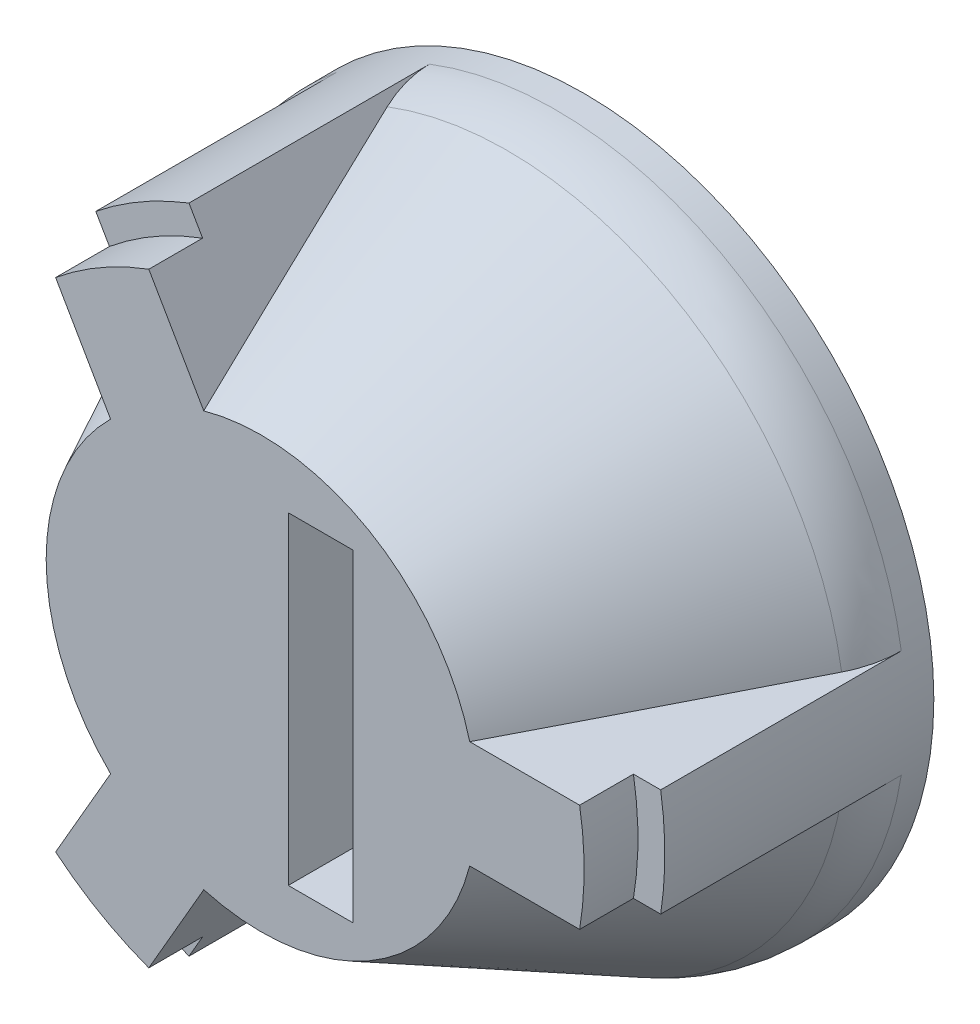
from build123d import *

# Parameters (mm, degrees)
BOSS_EXTRU_1_DEPTH      = 12
ESQUISSE5_R             = 12.2
ENL_V_MAT_EXTRU_1_DEPTH = 2.5
CONG_2_R                = 4
ESQUISSE7_W             = 2.4
ESQUISSE7_H             = 12
ENL_V_MAT_EXTRU_2_DEPTH = 5


with BuildPart() as part:
    # Esquisse1 → Boss.-Extru.1 (new body)
    with BuildSketch(Plane.XY):
        with BuildLine():
            ThreePointArc((13.856406461, -2), (14, 0), (13.856406461, 2))
            Line((13.856406461, 2), (7.745966692, 2))
            ThreePointArc((7.745966692, 2), (6.368966176, 4.841102131), (4, 6.92820323))
            ThreePointArc((4, 6.92820323), (1.00803434, 7.93623757), (-2.140932539, 7.708203932))
            Line((-2.140932539, 7.708203932), (-5.196152423, 13))
            ThreePointArc((-5.196152423, 13), (-7, 12.124355653), (-8.660254038, 11))
            Line((-8.660254038, 11), (-5.605034154, 5.708203932))
            ThreePointArc((-5.605034154, 5.708203932), (-7.377000516, 3.095135439), (-8, 0))
            ThreePointArc((-8, 0), (-7.377000516, -3.095135439), (-5.605034154, -5.708203932))
            Line((-5.605034154, -5.708203932), (-8.660254038, -11))
            ThreePointArc((-8.660254038, -11), (-7, -12.124355653), (-5.196152423, -13))
            Line((-5.196152423, -13), (-2.140932539, -7.708203932))
            ThreePointArc((-2.140932539, -7.708203932), (1.00803434, -7.93623757), (4, -6.92820323))
            ThreePointArc((4, -6.92820323), (6.368966176, -4.841102131), (7.745966692, -2))
            Line((7.745966692, -2), (13.856406461, -2))
        make_face()
    extrude(amount=BOSS_EXTRU_1_DEPTH)

    # Esquisse4 → Révolution1 (revolve)
    with BuildSketch(Plane(origin=(0, 0, 0), x_dir=(1, 0, 0), z_dir=(0, 1, 0))):
        Polygon((14, 0), (8, -12), (0, -12), (0, 0), align=None)
    revolve(axis=Axis((0, 0, 12), (0, 0, -1)))

    # Esquisse5 → Enlèv. mat.-Extru.1 (cut)
    with BuildSketch(Plane(origin=(0, 0, 0), x_dir=(-1, 0, 0), z_dir=(0, 0, -1))):
        Circle(ESQUISSE5_R)
    extrude(amount=-ENL_V_MAT_EXTRU_1_DEPTH, mode=Mode.SUBTRACT)

    # Esquisse6 → Enlèvement de matière-Révolution1 (revolve, cut)
    with BuildSketch(Plane(origin=(0, 0, 0), x_dir=(1, 0, 0), z_dir=(0, 1, 0))):
        Polygon((13, 0), (15.480754368, 0), (15.480754368, -12), (13, -12), (12, -12), (12, -10), (13, -10), align=None)
    revolve(axis=Axis((0, 0, 0), (0, 0, 1)), mode=Mode.SUBTRACT)

    # Congé2
    cong_2_edges = [part.edges().sort_by_distance(p)[0] for p in [
        (-13, 0, 2),
        (6.5, -11.258330249, 2),
        (6.5, 11.258330249, 2),
    ]]
    fillet(cong_2_edges, radius=CONG_2_R)

    # Esquisse7 → Enlèv. mat.-Extru.2 (cut)
    with BuildSketch(Plane.XY.offset(12)):
        with Locations((2.2, 0)):
            Rectangle(ESQUISSE7_W, ESQUISSE7_H)
    extrude(amount=-ENL_V_MAT_EXTRU_2_DEPTH, mode=Mode.SUBTRACT)


solid = part.part
